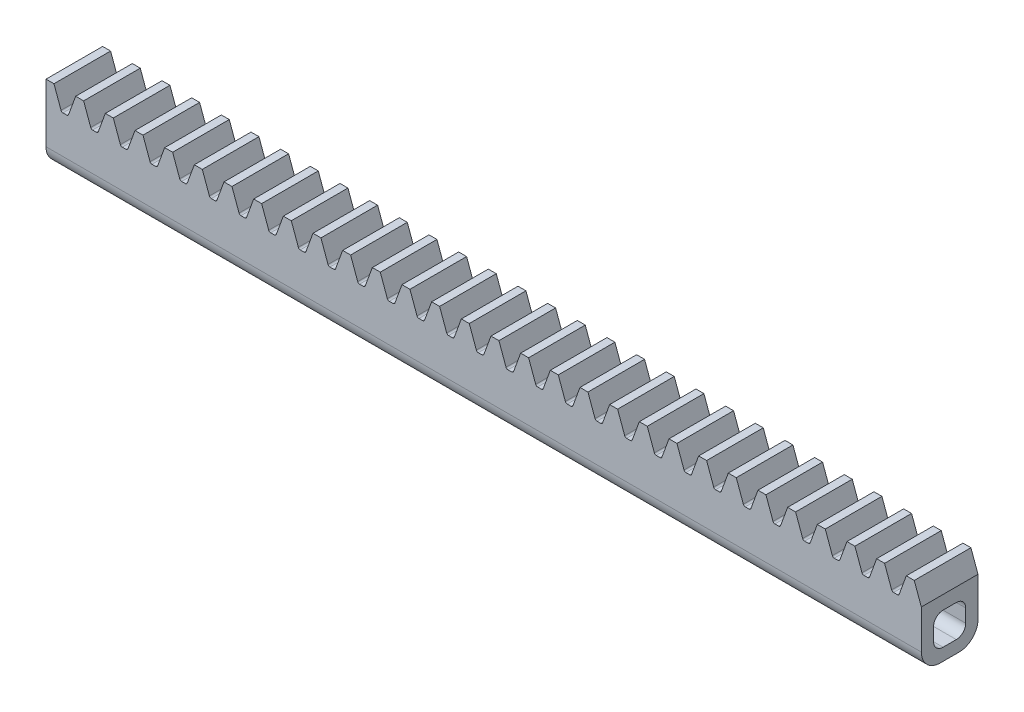
from build123d import *

# Parameters (mm, degrees)
BOSS_EXTRUDE1_DEPTH             = 157.5
BOSS_EXTRUDE1_DEPTH_BACK        = 157.5
SKETCH3_W                       = 10
SKETCH3_H                       = 10
CUT_EXTRUDE1_DEPTH              = 158.658650254
FILLET1_R                       = 0.209179931
LPATTERN1_START                 = -5
LPATTERN1_DEPTH                 = 10
SKETCH7_W                       = 229.169539732
SKETCH7_H                       = 18.859276409
CUT_EXTRUDE2_DEPTH              = 10
SKETCH9_W                       = 103.614124197
SKETCH9_H                       = 20.396946695
CUT_EXTRUDE4_DEPTH              = 4
SKETCH12_W                      = 3.4
SKETCH12_H                      = 3.4
CUT_EXTRUDE7_DEPTH              = 97.57510207
FILLET2_R                       = 1
CUT_EXTRUDE8_DEPTH              = 158.69353189
SKETCH14_W                      = 6
SKETCH14_H                      = 1.8
CUT_EXTRUDE9_DEPTH              = 93.968900729
FILLET3_R                       = 2
CUT_EXTRUDE10_REACH             = 159.793
SKETCH15_R                      = 1
CUT_EXTRUDE10_DIRECTION_2_DEPTH = 158.79255369
CUT_EXTRUDE11_REACH             = 159.793
SKETCH16_R                      = 1


# Read off the part's stored shape, not the designer's step: LPattern1
with BuildPart() as part:
    # Sketch3 → Boss-Extrude1 (new, two sides: drawn at the far end of the back side and taken through both)
    with BuildSketch(Plane(origin=(0, 0, 0), x_dir=(0, 0, -1), z_dir=(1, 0, 0)).offset(-BOSS_EXTRUDE1_DEPTH_BACK)):
        Rectangle(SKETCH3_W, SKETCH3_H)
    extrude(amount=BOSS_EXTRUDE1_DEPTH + BOSS_EXTRUDE1_DEPTH_BACK)

    # Sketch4 → Cut-Extrude1 (cut, symmetric)
    with BuildSketch(Plane.XY):
        Polygon((-156.657145469, 5), (-155.856410953, 2.8), (-155.159144515, 2.8), (-154.35841, 5), align=None)
    extrude(amount=CUT_EXTRUDE1_DEPTH, both=True, mode=Mode.SUBTRACT)

    # Fillet1
    fillet1_edges = [part.edges().sort_by_distance(p)[0] for p in [
        (-155.159144515, 2.8, 0),
        (-155.856410953, 2.8, 0),
    ]]
    fillet(fillet1_edges, radius=FILLET1_R)

    # LPattern1 outline → LPattern1 (cut)
    with BuildSketch(Plane.XY.offset(LPATTERN1_START)):
        with BuildLine():
            ThreePointArc((-152.764916426, 2.937636181), (-152.688332268, 2.837829763), (-152.568351588, 2.8))
            Line((-152.568351588, 2.8), (-152.16402388, 2.8))
            ThreePointArc((-152.16402388, 2.8), (-152.044043201, 2.837829763), (-151.967459042, 2.937636181))
            Line((-151.967459042, 2.937636181), (-151.21682, 5))
            Line((-151.21682, 5), (-153.515555469, 5))
            Line((-153.515555469, 5), (-152.764916426, 2.937636181))
        make_face()
        with BuildLine():
            Line((156.659, 5), (154.360264531, 5))
            Line((154.360264531, 5), (155.110903574, 2.937636181))
            ThreePointArc((155.110903574, 2.937636181), (155.187487732, 2.837829763), (155.307468412, 2.8))
            Line((155.307468412, 2.8), (155.71179612, 2.8))
            ThreePointArc((155.71179612, 2.8), (155.831776799, 2.837829763), (155.908360958, 2.937636181))
            Line((155.908360958, 2.937636181), (156.659, 5))
        make_face()
        with BuildLine():
            Line((153.51741, 5), (151.218674531, 5))
            Line((151.218674531, 5), (151.969313574, 2.937636181))
            ThreePointArc((151.969313574, 2.937636181), (152.045897732, 2.837829763), (152.165878412, 2.8))
            Line((152.165878412, 2.8), (152.57020612, 2.8))
            ThreePointArc((152.57020612, 2.8), (152.690186799, 2.837829763), (152.766770958, 2.937636181))
            Line((152.766770958, 2.937636181), (153.51741, 5))
        make_face()
        with BuildLine():
            Line((150.37582, 5), (148.077084531, 5))
            Line((148.077084531, 5), (148.827723574, 2.937636181))
            ThreePointArc((148.827723574, 2.937636181), (148.904307732, 2.837829763), (149.024288412, 2.8))
            Line((149.024288412, 2.8), (149.42861612, 2.8))
            ThreePointArc((149.42861612, 2.8), (149.548596799, 2.837829763), (149.625180958, 2.937636181))
            Line((149.625180958, 2.937636181), (150.37582, 5))
        make_face()
        with BuildLine():
            Line((147.23423, 5), (144.935494531, 5))
            Line((144.935494531, 5), (145.686133574, 2.937636181))
            ThreePointArc((145.686133574, 2.937636181), (145.762717732, 2.837829763), (145.882698412, 2.8))
            Line((145.882698412, 2.8), (146.28702612, 2.8))
            ThreePointArc((146.28702612, 2.8), (146.407006799, 2.837829763), (146.483590958, 2.937636181))
            Line((146.483590958, 2.937636181), (147.23423, 5))
        make_face()
        with BuildLine():
            Line((144.09264, 5), (141.793904531, 5))
            Line((141.793904531, 5), (142.544543574, 2.937636181))
            ThreePointArc((142.544543574, 2.937636181), (142.621127732, 2.837829763), (142.741108412, 2.8))
            Line((142.741108412, 2.8), (143.14543612, 2.8))
            ThreePointArc((143.14543612, 2.8), (143.265416799, 2.837829763), (143.342000958, 2.937636181))
            Line((143.342000958, 2.937636181), (144.09264, 5))
        make_face()
        with BuildLine():
            Line((140.95105, 5), (138.652314531, 5))
            Line((138.652314531, 5), (139.402953574, 2.937636181))
            ThreePointArc((139.402953574, 2.937636181), (139.479537732, 2.837829763), (139.599518412, 2.8))
            Line((139.599518412, 2.8), (140.00384612, 2.8))
            ThreePointArc((140.00384612, 2.8), (140.123826799, 2.837829763), (140.200410958, 2.937636181))
            Line((140.200410958, 2.937636181), (140.95105, 5))
        make_face()
        with BuildLine():
            Line((137.80946, 5), (135.510724531, 5))
            Line((135.510724531, 5), (136.261363574, 2.937636181))
            ThreePointArc((136.261363574, 2.937636181), (136.337947732, 2.837829763), (136.457928412, 2.8))
            Line((136.457928412, 2.8), (136.86225612, 2.8))
            ThreePointArc((136.86225612, 2.8), (136.982236799, 2.837829763), (137.058820958, 2.937636181))
            Line((137.058820958, 2.937636181), (137.80946, 5))
        make_face()
        with BuildLine():
            Line((134.66787, 5), (132.369134531, 5))
            Line((132.369134531, 5), (133.119773574, 2.937636181))
            ThreePointArc((133.119773574, 2.937636181), (133.196357732, 2.837829763), (133.316338412, 2.8))
            Line((133.316338412, 2.8), (133.72066612, 2.8))
            ThreePointArc((133.72066612, 2.8), (133.840646799, 2.837829763), (133.917230958, 2.937636181))
            Line((133.917230958, 2.937636181), (134.66787, 5))
        make_face()
        with BuildLine():
            Line((131.52628, 5), (129.227544531, 5))
            Line((129.227544531, 5), (129.978183574, 2.937636181))
            ThreePointArc((129.978183574, 2.937636181), (130.054767732, 2.837829763), (130.174748412, 2.8))
            Line((130.174748412, 2.8), (130.57907612, 2.8))
            ThreePointArc((130.57907612, 2.8), (130.699056799, 2.837829763), (130.775640958, 2.937636181))
            Line((130.775640958, 2.937636181), (131.52628, 5))
        make_face()
        with BuildLine():
            Line((128.38469, 5), (126.085954531, 5))
            Line((126.085954531, 5), (126.836593574, 2.937636181))
            ThreePointArc((126.836593574, 2.937636181), (126.913177732, 2.837829763), (127.033158412, 2.8))
            Line((127.033158412, 2.8), (127.43748612, 2.8))
            ThreePointArc((127.43748612, 2.8), (127.557466799, 2.837829763), (127.634050958, 2.937636181))
            Line((127.634050958, 2.937636181), (128.38469, 5))
        make_face()
        with BuildLine():
            Line((125.2431, 5), (122.944364531, 5))
            Line((122.944364531, 5), (123.695003574, 2.937636181))
            ThreePointArc((123.695003574, 2.937636181), (123.771587732, 2.837829763), (123.891568412, 2.8))
            Line((123.891568412, 2.8), (124.29589612, 2.8))
            ThreePointArc((124.29589612, 2.8), (124.415876799, 2.837829763), (124.492460958, 2.937636181))
            Line((124.492460958, 2.937636181), (125.2431, 5))
        make_face()
        with BuildLine():
            Line((122.10151, 5), (119.802774531, 5))
            Line((119.802774531, 5), (120.553413574, 2.937636181))
            ThreePointArc((120.553413574, 2.937636181), (120.629997732, 2.837829763), (120.749978412, 2.8))
            Line((120.749978412, 2.8), (121.15430612, 2.8))
            ThreePointArc((121.15430612, 2.8), (121.274286799, 2.837829763), (121.350870958, 2.937636181))
            Line((121.350870958, 2.937636181), (122.10151, 5))
        make_face()
        with BuildLine():
            Line((118.95992, 5), (116.661184531, 5))
            Line((116.661184531, 5), (117.411823574, 2.937636181))
            ThreePointArc((117.411823574, 2.937636181), (117.488407732, 2.837829763), (117.608388412, 2.8))
            Line((117.608388412, 2.8), (118.01271612, 2.8))
            ThreePointArc((118.01271612, 2.8), (118.132696799, 2.837829763), (118.209280958, 2.937636181))
            Line((118.209280958, 2.937636181), (118.95992, 5))
        make_face()
        with BuildLine():
            Line((115.81833, 5), (113.519594531, 5))
            Line((113.519594531, 5), (114.270233574, 2.937636181))
            ThreePointArc((114.270233574, 2.937636181), (114.346817732, 2.837829763), (114.466798412, 2.8))
            Line((114.466798412, 2.8), (114.87112612, 2.8))
            ThreePointArc((114.87112612, 2.8), (114.991106799, 2.837829763), (115.067690958, 2.937636181))
            Line((115.067690958, 2.937636181), (115.81833, 5))
        make_face()
        with BuildLine():
            Line((112.67674, 5), (110.378004531, 5))
            Line((110.378004531, 5), (111.128643574, 2.937636181))
            ThreePointArc((111.128643574, 2.937636181), (111.205227732, 2.837829763), (111.325208412, 2.8))
            Line((111.325208412, 2.8), (111.72953612, 2.8))
            ThreePointArc((111.72953612, 2.8), (111.849516799, 2.837829763), (111.926100958, 2.937636181))
            Line((111.926100958, 2.937636181), (112.67674, 5))
        make_face()
        with BuildLine():
            Line((109.53515, 5), (107.236414531, 5))
            Line((107.236414531, 5), (107.987053574, 2.937636181))
            ThreePointArc((107.987053574, 2.937636181), (108.063637732, 2.837829763), (108.183618412, 2.8))
            Line((108.183618412, 2.8), (108.58794612, 2.8))
            ThreePointArc((108.58794612, 2.8), (108.707926799, 2.837829763), (108.784510958, 2.937636181))
            Line((108.784510958, 2.937636181), (109.53515, 5))
        make_face()
        with BuildLine():
            Line((106.39356, 5), (104.094824531, 5))
            Line((104.094824531, 5), (104.845463574, 2.937636181))
            ThreePointArc((104.845463574, 2.937636181), (104.922047732, 2.837829763), (105.042028412, 2.8))
            Line((105.042028412, 2.8), (105.44635612, 2.8))
            ThreePointArc((105.44635612, 2.8), (105.566336799, 2.837829763), (105.642920958, 2.937636181))
            Line((105.642920958, 2.937636181), (106.39356, 5))
        make_face()
        with BuildLine():
            Line((103.25197, 5), (100.953234531, 5))
            Line((100.953234531, 5), (101.703873574, 2.937636181))
            ThreePointArc((101.703873574, 2.937636181), (101.780457732, 2.837829763), (101.900438412, 2.8))
            Line((101.900438412, 2.8), (102.30476612, 2.8))
            ThreePointArc((102.30476612, 2.8), (102.424746799, 2.837829763), (102.501330958, 2.937636181))
            Line((102.501330958, 2.937636181), (103.25197, 5))
        make_face()
        with BuildLine():
            Line((100.11038, 5), (97.811644531, 5))
            Line((97.811644531, 5), (98.562283574, 2.937636181))
            ThreePointArc((98.562283574, 2.937636181), (98.638867732, 2.837829763), (98.758848412, 2.8))
            Line((98.758848412, 2.8), (99.16317612, 2.8))
            ThreePointArc((99.16317612, 2.8), (99.283156799, 2.837829763), (99.359740958, 2.937636181))
            Line((99.359740958, 2.937636181), (100.11038, 5))
        make_face()
        with BuildLine():
            Line((96.96879, 5), (94.670054531, 5))
            Line((94.670054531, 5), (95.420693574, 2.937636181))
            ThreePointArc((95.420693574, 2.937636181), (95.497277732, 2.837829763), (95.617258412, 2.8))
            Line((95.617258412, 2.8), (96.02158612, 2.8))
            ThreePointArc((96.02158612, 2.8), (96.141566799, 2.837829763), (96.218150958, 2.937636181))
            Line((96.218150958, 2.937636181), (96.96879, 5))
        make_face()
        with BuildLine():
            Line((93.8272, 5), (91.528464531, 5))
            Line((91.528464531, 5), (92.279103574, 2.937636181))
            ThreePointArc((92.279103574, 2.937636181), (92.355687732, 2.837829763), (92.475668412, 2.8))
            Line((92.475668412, 2.8), (92.87999612, 2.8))
            ThreePointArc((92.87999612, 2.8), (92.999976799, 2.837829763), (93.076560958, 2.937636181))
            Line((93.076560958, 2.937636181), (93.8272, 5))
        make_face()
        with BuildLine():
            Line((90.68561, 5), (88.386874531, 5))
            Line((88.386874531, 5), (89.137513574, 2.937636181))
            ThreePointArc((89.137513574, 2.937636181), (89.214097732, 2.837829763), (89.334078412, 2.8))
            Line((89.334078412, 2.8), (89.73840612, 2.8))
            ThreePointArc((89.73840612, 2.8), (89.858386799, 2.837829763), (89.934970958, 2.937636181))
            Line((89.934970958, 2.937636181), (90.68561, 5))
        make_face()
        with BuildLine():
            Line((87.54402, 5), (85.245284531, 5))
            Line((85.245284531, 5), (85.995923574, 2.937636181))
            ThreePointArc((85.995923574, 2.937636181), (86.072507732, 2.837829763), (86.192488412, 2.8))
            Line((86.192488412, 2.8), (86.59681612, 2.8))
            ThreePointArc((86.59681612, 2.8), (86.716796799, 2.837829763), (86.793380958, 2.937636181))
            Line((86.793380958, 2.937636181), (87.54402, 5))
        make_face()
        with BuildLine():
            Line((84.40243, 5), (82.103694531, 5))
            Line((82.103694531, 5), (82.854333574, 2.937636181))
            ThreePointArc((82.854333574, 2.937636181), (82.930917732, 2.837829763), (83.050898412, 2.8))
            Line((83.050898412, 2.8), (83.45522612, 2.8))
            ThreePointArc((83.45522612, 2.8), (83.575206799, 2.837829763), (83.651790958, 2.937636181))
            Line((83.651790958, 2.937636181), (84.40243, 5))
        make_face()
        with BuildLine():
            Line((81.26084, 5), (78.962104531, 5))
            Line((78.962104531, 5), (79.712743574, 2.937636181))
            ThreePointArc((79.712743574, 2.937636181), (79.789327732, 2.837829763), (79.909308412, 2.8))
            Line((79.909308412, 2.8), (80.31363612, 2.8))
            ThreePointArc((80.31363612, 2.8), (80.433616799, 2.837829763), (80.510200958, 2.937636181))
            Line((80.510200958, 2.937636181), (81.26084, 5))
        make_face()
        with BuildLine():
            Line((78.11925, 5), (75.820514531, 5))
            Line((75.820514531, 5), (76.571153574, 2.937636181))
            ThreePointArc((76.571153574, 2.937636181), (76.647737732, 2.837829763), (76.767718412, 2.8))
            Line((76.767718412, 2.8), (77.17204612, 2.8))
            ThreePointArc((77.17204612, 2.8), (77.292026799, 2.837829763), (77.368610958, 2.937636181))
            Line((77.368610958, 2.937636181), (78.11925, 5))
        make_face()
        with BuildLine():
            Line((74.97766, 5), (72.678924531, 5))
            Line((72.678924531, 5), (73.429563574, 2.937636181))
            ThreePointArc((73.429563574, 2.937636181), (73.506147732, 2.837829763), (73.626128412, 2.8))
            Line((73.626128412, 2.8), (74.03045612, 2.8))
            ThreePointArc((74.03045612, 2.8), (74.150436799, 2.837829763), (74.227020958, 2.937636181))
            Line((74.227020958, 2.937636181), (74.97766, 5))
        make_face()
        with BuildLine():
            Line((71.83607, 5), (69.537334531, 5))
            Line((69.537334531, 5), (70.287973574, 2.937636181))
            ThreePointArc((70.287973574, 2.937636181), (70.364557732, 2.837829763), (70.484538412, 2.8))
            Line((70.484538412, 2.8), (70.88886612, 2.8))
            ThreePointArc((70.88886612, 2.8), (71.008846799, 2.837829763), (71.085430958, 2.937636181))
            Line((71.085430958, 2.937636181), (71.83607, 5))
        make_face()
        with BuildLine():
            Line((68.69448, 5), (66.395744531, 5))
            Line((66.395744531, 5), (67.146383574, 2.937636181))
            ThreePointArc((67.146383574, 2.937636181), (67.222967732, 2.837829763), (67.342948412, 2.8))
            Line((67.342948412, 2.8), (67.74727612, 2.8))
            ThreePointArc((67.74727612, 2.8), (67.867256799, 2.837829763), (67.943840958, 2.937636181))
            Line((67.943840958, 2.937636181), (68.69448, 5))
        make_face()
        with BuildLine():
            Line((65.55289, 5), (63.254154531, 5))
            Line((63.254154531, 5), (64.004793574, 2.937636181))
            ThreePointArc((64.004793574, 2.937636181), (64.081377732, 2.837829763), (64.201358412, 2.8))
            Line((64.201358412, 2.8), (64.60568612, 2.8))
            ThreePointArc((64.60568612, 2.8), (64.725666799, 2.837829763), (64.802250958, 2.937636181))
            Line((64.802250958, 2.937636181), (65.55289, 5))
        make_face()
        with BuildLine():
            Line((62.4113, 5), (60.112564531, 5))
            Line((60.112564531, 5), (60.863203574, 2.937636181))
            ThreePointArc((60.863203574, 2.937636181), (60.939787732, 2.837829763), (61.059768412, 2.8))
            Line((61.059768412, 2.8), (61.46409612, 2.8))
            ThreePointArc((61.46409612, 2.8), (61.584076799, 2.837829763), (61.660660958, 2.937636181))
            Line((61.660660958, 2.937636181), (62.4113, 5))
        make_face()
        with BuildLine():
            Line((59.26971, 5), (56.970974531, 5))
            Line((56.970974531, 5), (57.721613574, 2.937636181))
            ThreePointArc((57.721613574, 2.937636181), (57.798197732, 2.837829763), (57.918178412, 2.8))
            Line((57.918178412, 2.8), (58.32250612, 2.8))
            ThreePointArc((58.32250612, 2.8), (58.442486799, 2.837829763), (58.519070958, 2.937636181))
            Line((58.519070958, 2.937636181), (59.26971, 5))
        make_face()
        with BuildLine():
            Line((56.12812, 5), (53.829384531, 5))
            Line((53.829384531, 5), (54.580023574, 2.937636181))
            ThreePointArc((54.580023574, 2.937636181), (54.656607732, 2.837829763), (54.776588412, 2.8))
            Line((54.776588412, 2.8), (55.18091612, 2.8))
            ThreePointArc((55.18091612, 2.8), (55.300896799, 2.837829763), (55.377480958, 2.937636181))
            Line((55.377480958, 2.937636181), (56.12812, 5))
        make_face()
        with BuildLine():
            Line((52.98653, 5), (50.687794531, 5))
            Line((50.687794531, 5), (51.438433574, 2.937636181))
            ThreePointArc((51.438433574, 2.937636181), (51.515017732, 2.837829763), (51.634998412, 2.8))
            Line((51.634998412, 2.8), (52.03932612, 2.8))
            ThreePointArc((52.03932612, 2.8), (52.159306799, 2.837829763), (52.235890958, 2.937636181))
            Line((52.235890958, 2.937636181), (52.98653, 5))
        make_face()
        with BuildLine():
            Line((49.84494, 5), (47.546204531, 5))
            Line((47.546204531, 5), (48.296843574, 2.937636181))
            ThreePointArc((48.296843574, 2.937636181), (48.373427732, 2.837829763), (48.493408412, 2.8))
            Line((48.493408412, 2.8), (48.89773612, 2.8))
            ThreePointArc((48.89773612, 2.8), (49.017716799, 2.837829763), (49.094300958, 2.937636181))
            Line((49.094300958, 2.937636181), (49.84494, 5))
        make_face()
        with BuildLine():
            Line((46.70335, 5), (44.404614531, 5))
            Line((44.404614531, 5), (45.155253574, 2.937636181))
            ThreePointArc((45.155253574, 2.937636181), (45.231837732, 2.837829763), (45.351818412, 2.8))
            Line((45.351818412, 2.8), (45.75614612, 2.8))
            ThreePointArc((45.75614612, 2.8), (45.876126799, 2.837829763), (45.952710958, 2.937636181))
            Line((45.952710958, 2.937636181), (46.70335, 5))
        make_face()
        with BuildLine():
            Line((43.56176, 5), (41.263024531, 5))
            Line((41.263024531, 5), (42.013663574, 2.937636181))
            ThreePointArc((42.013663574, 2.937636181), (42.090247732, 2.837829763), (42.210228412, 2.8))
            Line((42.210228412, 2.8), (42.61455612, 2.8))
            ThreePointArc((42.61455612, 2.8), (42.734536799, 2.837829763), (42.811120958, 2.937636181))
            Line((42.811120958, 2.937636181), (43.56176, 5))
        make_face()
        with BuildLine():
            Line((40.42017, 5), (38.121434531, 5))
            Line((38.121434531, 5), (38.872073574, 2.937636181))
            ThreePointArc((38.872073574, 2.937636181), (38.948657732, 2.837829763), (39.068638412, 2.8))
            Line((39.068638412, 2.8), (39.47296612, 2.8))
            ThreePointArc((39.47296612, 2.8), (39.592946799, 2.837829763), (39.669530958, 2.937636181))
            Line((39.669530958, 2.937636181), (40.42017, 5))
        make_face()
        with BuildLine():
            Line((37.27858, 5), (34.979844531, 5))
            Line((34.979844531, 5), (35.730483574, 2.937636181))
            ThreePointArc((35.730483574, 2.937636181), (35.807067732, 2.837829763), (35.927048412, 2.8))
            Line((35.927048412, 2.8), (36.33137612, 2.8))
            ThreePointArc((36.33137612, 2.8), (36.451356799, 2.837829763), (36.527940958, 2.937636181))
            Line((36.527940958, 2.937636181), (37.27858, 5))
        make_face()
        with BuildLine():
            Line((34.13699, 5), (31.838254531, 5))
            Line((31.838254531, 5), (32.588893574, 2.937636181))
            ThreePointArc((32.588893574, 2.937636181), (32.665477732, 2.837829763), (32.785458412, 2.8))
            Line((32.785458412, 2.8), (33.18978612, 2.8))
            ThreePointArc((33.18978612, 2.8), (33.309766799, 2.837829763), (33.386350958, 2.937636181))
            Line((33.386350958, 2.937636181), (34.13699, 5))
        make_face()
        with BuildLine():
            Line((30.9954, 5), (28.696664531, 5))
            Line((28.696664531, 5), (29.447303574, 2.937636181))
            ThreePointArc((29.447303574, 2.937636181), (29.523887732, 2.837829763), (29.643868412, 2.8))
            Line((29.643868412, 2.8), (30.04819612, 2.8))
            ThreePointArc((30.04819612, 2.8), (30.168176799, 2.837829763), (30.244760958, 2.937636181))
            Line((30.244760958, 2.937636181), (30.9954, 5))
        make_face()
        with BuildLine():
            Line((27.85381, 5), (25.555074531, 5))
            Line((25.555074531, 5), (26.305713574, 2.937636181))
            ThreePointArc((26.305713574, 2.937636181), (26.382297732, 2.837829763), (26.502278412, 2.8))
            Line((26.502278412, 2.8), (26.90660612, 2.8))
            ThreePointArc((26.90660612, 2.8), (27.026586799, 2.837829763), (27.103170958, 2.937636181))
            Line((27.103170958, 2.937636181), (27.85381, 5))
        make_face()
        with BuildLine():
            Line((24.71222, 5), (22.413484531, 5))
            Line((22.413484531, 5), (23.164123574, 2.937636181))
            ThreePointArc((23.164123574, 2.937636181), (23.240707732, 2.837829763), (23.360688412, 2.8))
            Line((23.360688412, 2.8), (23.76501612, 2.8))
            ThreePointArc((23.76501612, 2.8), (23.884996799, 2.837829763), (23.961580958, 2.937636181))
            Line((23.961580958, 2.937636181), (24.71222, 5))
        make_face()
        with BuildLine():
            Line((21.57063, 5), (19.271894531, 5))
            Line((19.271894531, 5), (20.022533574, 2.937636181))
            ThreePointArc((20.022533574, 2.937636181), (20.099117732, 2.837829763), (20.219098412, 2.8))
            Line((20.219098412, 2.8), (20.62342612, 2.8))
            ThreePointArc((20.62342612, 2.8), (20.743406799, 2.837829763), (20.819990958, 2.937636181))
            Line((20.819990958, 2.937636181), (21.57063, 5))
        make_face()
        with BuildLine():
            Line((18.42904, 5), (16.130304531, 5))
            Line((16.130304531, 5), (16.880943574, 2.937636181))
            ThreePointArc((16.880943574, 2.937636181), (16.957527732, 2.837829763), (17.077508412, 2.8))
            Line((17.077508412, 2.8), (17.48183612, 2.8))
            ThreePointArc((17.48183612, 2.8), (17.601816799, 2.837829763), (17.678400958, 2.937636181))
            Line((17.678400958, 2.937636181), (18.42904, 5))
        make_face()
        with BuildLine():
            Line((15.28745, 5), (12.988714531, 5))
            Line((12.988714531, 5), (13.739353574, 2.937636181))
            ThreePointArc((13.739353574, 2.937636181), (13.815937732, 2.837829763), (13.935918412, 2.8))
            Line((13.935918412, 2.8), (14.34024612, 2.8))
            ThreePointArc((14.34024612, 2.8), (14.460226799, 2.837829763), (14.536810958, 2.937636181))
            Line((14.536810958, 2.937636181), (15.28745, 5))
        make_face()
        with BuildLine():
            Line((12.14586, 5), (9.847124531, 5))
            Line((9.847124531, 5), (10.597763574, 2.937636181))
            ThreePointArc((10.597763574, 2.937636181), (10.674347732, 2.837829763), (10.794328412, 2.8))
            Line((10.794328412, 2.8), (11.19865612, 2.8))
            ThreePointArc((11.19865612, 2.8), (11.318636799, 2.837829763), (11.395220958, 2.937636181))
            Line((11.395220958, 2.937636181), (12.14586, 5))
        make_face()
        with BuildLine():
            Line((9.00427, 5), (6.705534531, 5))
            Line((6.705534531, 5), (7.456173574, 2.937636181))
            ThreePointArc((7.456173574, 2.937636181), (7.532757732, 2.837829763), (7.652738412, 2.8))
            Line((7.652738412, 2.8), (8.05706612, 2.8))
            ThreePointArc((8.05706612, 2.8), (8.177046799, 2.837829763), (8.253630958, 2.937636181))
            Line((8.253630958, 2.937636181), (9.00427, 5))
        make_face()
        with BuildLine():
            Line((5.86268, 5), (3.563944531, 5))
            Line((3.563944531, 5), (4.314583574, 2.937636181))
            ThreePointArc((4.314583574, 2.937636181), (4.391167732, 2.837829763), (4.511148412, 2.8))
            Line((4.511148412, 2.8), (4.91547612, 2.8))
            ThreePointArc((4.91547612, 2.8), (5.035456799, 2.837829763), (5.112040958, 2.937636181))
            Line((5.112040958, 2.937636181), (5.86268, 5))
        make_face()
        with BuildLine():
            Line((2.72109, 5), (0.422354531, 5))
            Line((0.422354531, 5), (1.172993574, 2.937636181))
            ThreePointArc((1.172993574, 2.937636181), (1.249577732, 2.837829763), (1.369558412, 2.8))
            Line((1.369558412, 2.8), (1.77388612, 2.8))
            ThreePointArc((1.77388612, 2.8), (1.893866799, 2.837829763), (1.970450958, 2.937636181))
            Line((1.970450958, 2.937636181), (2.72109, 5))
        make_face()
        with BuildLine():
            Line((-0.4205, 5), (-2.719235469, 5))
            Line((-2.719235469, 5), (-1.968596426, 2.937636181))
            ThreePointArc((-1.968596426, 2.937636181), (-1.892012268, 2.837829763), (-1.772031588, 2.8))
            Line((-1.772031588, 2.8), (-1.36770388, 2.8))
            ThreePointArc((-1.36770388, 2.8), (-1.247723201, 2.837829763), (-1.171139042, 2.937636181))
            Line((-1.171139042, 2.937636181), (-0.4205, 5))
        make_face()
        with BuildLine():
            Line((-3.56209, 5), (-5.860825469, 5))
            Line((-5.860825469, 5), (-5.110186426, 2.937636181))
            ThreePointArc((-5.110186426, 2.937636181), (-5.033602268, 2.837829763), (-4.913621588, 2.8))
            Line((-4.913621588, 2.8), (-4.50929388, 2.8))
            ThreePointArc((-4.50929388, 2.8), (-4.389313201, 2.837829763), (-4.312729042, 2.937636181))
            Line((-4.312729042, 2.937636181), (-3.56209, 5))
        make_face()
        with BuildLine():
            Line((-6.70368, 5), (-9.002415469, 5))
            Line((-9.002415469, 5), (-8.251776426, 2.937636181))
            ThreePointArc((-8.251776426, 2.937636181), (-8.175192268, 2.837829763), (-8.055211588, 2.8))
            Line((-8.055211588, 2.8), (-7.65088388, 2.8))
            ThreePointArc((-7.65088388, 2.8), (-7.530903201, 2.837829763), (-7.454319042, 2.937636181))
            Line((-7.454319042, 2.937636181), (-6.70368, 5))
        make_face()
        with BuildLine():
            Line((-9.84527, 5), (-12.144005469, 5))
            Line((-12.144005469, 5), (-11.393366426, 2.937636181))
            ThreePointArc((-11.393366426, 2.937636181), (-11.316782268, 2.837829763), (-11.196801588, 2.8))
            Line((-11.196801588, 2.8), (-10.79247388, 2.8))
            ThreePointArc((-10.79247388, 2.8), (-10.672493201, 2.837829763), (-10.595909042, 2.937636181))
            Line((-10.595909042, 2.937636181), (-9.84527, 5))
        make_face()
        with BuildLine():
            Line((-12.98686, 5), (-15.285595469, 5))
            Line((-15.285595469, 5), (-14.534956426, 2.937636181))
            ThreePointArc((-14.534956426, 2.937636181), (-14.458372268, 2.837829763), (-14.338391588, 2.8))
            Line((-14.338391588, 2.8), (-13.93406388, 2.8))
            ThreePointArc((-13.93406388, 2.8), (-13.814083201, 2.837829763), (-13.737499042, 2.937636181))
            Line((-13.737499042, 2.937636181), (-12.98686, 5))
        make_face()
        with BuildLine():
            Line((-16.12845, 5), (-18.427185469, 5))
            Line((-18.427185469, 5), (-17.676546426, 2.937636181))
            ThreePointArc((-17.676546426, 2.937636181), (-17.599962268, 2.837829763), (-17.479981588, 2.8))
            Line((-17.479981588, 2.8), (-17.07565388, 2.8))
            ThreePointArc((-17.07565388, 2.8), (-16.955673201, 2.837829763), (-16.879089042, 2.937636181))
            Line((-16.879089042, 2.937636181), (-16.12845, 5))
        make_face()
        with BuildLine():
            Line((-19.27004, 5), (-21.568775469, 5))
            Line((-21.568775469, 5), (-20.818136426, 2.937636181))
            ThreePointArc((-20.818136426, 2.937636181), (-20.741552268, 2.837829763), (-20.621571588, 2.8))
            Line((-20.621571588, 2.8), (-20.21724388, 2.8))
            ThreePointArc((-20.21724388, 2.8), (-20.097263201, 2.837829763), (-20.020679042, 2.937636181))
            Line((-20.020679042, 2.937636181), (-19.27004, 5))
        make_face()
        with BuildLine():
            Line((-22.41163, 5), (-24.710365469, 5))
            Line((-24.710365469, 5), (-23.959726426, 2.937636181))
            ThreePointArc((-23.959726426, 2.937636181), (-23.883142268, 2.837829763), (-23.763161588, 2.8))
            Line((-23.763161588, 2.8), (-23.35883388, 2.8))
            ThreePointArc((-23.35883388, 2.8), (-23.238853201, 2.837829763), (-23.162269042, 2.937636181))
            Line((-23.162269042, 2.937636181), (-22.41163, 5))
        make_face()
        with BuildLine():
            Line((-25.55322, 5), (-27.851955469, 5))
            Line((-27.851955469, 5), (-27.101316426, 2.937636181))
            ThreePointArc((-27.101316426, 2.937636181), (-27.024732268, 2.837829763), (-26.904751588, 2.8))
            Line((-26.904751588, 2.8), (-26.50042388, 2.8))
            ThreePointArc((-26.50042388, 2.8), (-26.380443201, 2.837829763), (-26.303859042, 2.937636181))
            Line((-26.303859042, 2.937636181), (-25.55322, 5))
        make_face()
        with BuildLine():
            Line((-28.69481, 5), (-30.993545469, 5))
            Line((-30.993545469, 5), (-30.242906426, 2.937636181))
            ThreePointArc((-30.242906426, 2.937636181), (-30.166322268, 2.837829763), (-30.046341588, 2.8))
            Line((-30.046341588, 2.8), (-29.64201388, 2.8))
            ThreePointArc((-29.64201388, 2.8), (-29.522033201, 2.837829763), (-29.445449042, 2.937636181))
            Line((-29.445449042, 2.937636181), (-28.69481, 5))
        make_face()
        with BuildLine():
            Line((-31.8364, 5), (-34.135135469, 5))
            Line((-34.135135469, 5), (-33.384496426, 2.937636181))
            ThreePointArc((-33.384496426, 2.937636181), (-33.307912268, 2.837829763), (-33.187931588, 2.8))
            Line((-33.187931588, 2.8), (-32.78360388, 2.8))
            ThreePointArc((-32.78360388, 2.8), (-32.663623201, 2.837829763), (-32.587039042, 2.937636181))
            Line((-32.587039042, 2.937636181), (-31.8364, 5))
        make_face()
        with BuildLine():
            Line((-34.97799, 5), (-37.276725469, 5))
            Line((-37.276725469, 5), (-36.526086426, 2.937636181))
            ThreePointArc((-36.526086426, 2.937636181), (-36.449502268, 2.837829763), (-36.329521588, 2.8))
            Line((-36.329521588, 2.8), (-35.92519388, 2.8))
            ThreePointArc((-35.92519388, 2.8), (-35.805213201, 2.837829763), (-35.728629042, 2.937636181))
            Line((-35.728629042, 2.937636181), (-34.97799, 5))
        make_face()
        with BuildLine():
            Line((-38.11958, 5), (-40.418315469, 5))
            Line((-40.418315469, 5), (-39.667676426, 2.937636181))
            ThreePointArc((-39.667676426, 2.937636181), (-39.591092268, 2.837829763), (-39.471111588, 2.8))
            Line((-39.471111588, 2.8), (-39.06678388, 2.8))
            ThreePointArc((-39.06678388, 2.8), (-38.946803201, 2.837829763), (-38.870219042, 2.937636181))
            Line((-38.870219042, 2.937636181), (-38.11958, 5))
        make_face()
        with BuildLine():
            Line((-41.26117, 5), (-43.559905469, 5))
            Line((-43.559905469, 5), (-42.809266426, 2.937636181))
            ThreePointArc((-42.809266426, 2.937636181), (-42.732682268, 2.837829763), (-42.612701588, 2.8))
            Line((-42.612701588, 2.8), (-42.20837388, 2.8))
            ThreePointArc((-42.20837388, 2.8), (-42.088393201, 2.837829763), (-42.011809042, 2.937636181))
            Line((-42.011809042, 2.937636181), (-41.26117, 5))
        make_face()
        with BuildLine():
            Line((-44.40276, 5), (-46.701495469, 5))
            Line((-46.701495469, 5), (-45.950856426, 2.937636181))
            ThreePointArc((-45.950856426, 2.937636181), (-45.874272268, 2.837829763), (-45.754291588, 2.8))
            Line((-45.754291588, 2.8), (-45.34996388, 2.8))
            ThreePointArc((-45.34996388, 2.8), (-45.229983201, 2.837829763), (-45.153399042, 2.937636181))
            Line((-45.153399042, 2.937636181), (-44.40276, 5))
        make_face()
        with BuildLine():
            Line((-47.54435, 5), (-49.843085469, 5))
            Line((-49.843085469, 5), (-49.092446426, 2.937636181))
            ThreePointArc((-49.092446426, 2.937636181), (-49.015862268, 2.837829763), (-48.895881588, 2.8))
            Line((-48.895881588, 2.8), (-48.49155388, 2.8))
            ThreePointArc((-48.49155388, 2.8), (-48.371573201, 2.837829763), (-48.294989042, 2.937636181))
            Line((-48.294989042, 2.937636181), (-47.54435, 5))
        make_face()
        with BuildLine():
            Line((-50.68594, 5), (-52.984675469, 5))
            Line((-52.984675469, 5), (-52.234036426, 2.937636181))
            ThreePointArc((-52.234036426, 2.937636181), (-52.157452268, 2.837829763), (-52.037471588, 2.8))
            Line((-52.037471588, 2.8), (-51.63314388, 2.8))
            ThreePointArc((-51.63314388, 2.8), (-51.513163201, 2.837829763), (-51.436579042, 2.937636181))
            Line((-51.436579042, 2.937636181), (-50.68594, 5))
        make_face()
        with BuildLine():
            Line((-53.82753, 5), (-56.126265469, 5))
            Line((-56.126265469, 5), (-55.375626426, 2.937636181))
            ThreePointArc((-55.375626426, 2.937636181), (-55.299042268, 2.837829763), (-55.179061588, 2.8))
            Line((-55.179061588, 2.8), (-54.77473388, 2.8))
            ThreePointArc((-54.77473388, 2.8), (-54.654753201, 2.837829763), (-54.578169042, 2.937636181))
            Line((-54.578169042, 2.937636181), (-53.82753, 5))
        make_face()
        with BuildLine():
            Line((-56.96912, 5), (-59.267855469, 5))
            Line((-59.267855469, 5), (-58.517216426, 2.937636181))
            ThreePointArc((-58.517216426, 2.937636181), (-58.440632268, 2.837829763), (-58.320651588, 2.8))
            Line((-58.320651588, 2.8), (-57.91632388, 2.8))
            ThreePointArc((-57.91632388, 2.8), (-57.796343201, 2.837829763), (-57.719759042, 2.937636181))
            Line((-57.719759042, 2.937636181), (-56.96912, 5))
        make_face()
        with BuildLine():
            Line((-60.11071, 5), (-62.409445469, 5))
            Line((-62.409445469, 5), (-61.658806426, 2.937636181))
            ThreePointArc((-61.658806426, 2.937636181), (-61.582222268, 2.837829763), (-61.462241588, 2.8))
            Line((-61.462241588, 2.8), (-61.05791388, 2.8))
            ThreePointArc((-61.05791388, 2.8), (-60.937933201, 2.837829763), (-60.861349042, 2.937636181))
            Line((-60.861349042, 2.937636181), (-60.11071, 5))
        make_face()
        with BuildLine():
            Line((-63.2523, 5), (-65.551035469, 5))
            Line((-65.551035469, 5), (-64.800396426, 2.937636181))
            ThreePointArc((-64.800396426, 2.937636181), (-64.723812268, 2.837829763), (-64.603831588, 2.8))
            Line((-64.603831588, 2.8), (-64.19950388, 2.8))
            ThreePointArc((-64.19950388, 2.8), (-64.079523201, 2.837829763), (-64.002939042, 2.937636181))
            Line((-64.002939042, 2.937636181), (-63.2523, 5))
        make_face()
        with BuildLine():
            Line((-66.39389, 5), (-68.692625469, 5))
            Line((-68.692625469, 5), (-67.941986426, 2.937636181))
            ThreePointArc((-67.941986426, 2.937636181), (-67.865402268, 2.837829763), (-67.745421588, 2.8))
            Line((-67.745421588, 2.8), (-67.34109388, 2.8))
            ThreePointArc((-67.34109388, 2.8), (-67.221113201, 2.837829763), (-67.144529042, 2.937636181))
            Line((-67.144529042, 2.937636181), (-66.39389, 5))
        make_face()
        with BuildLine():
            Line((-69.53548, 5), (-71.834215469, 5))
            Line((-71.834215469, 5), (-71.083576426, 2.937636181))
            ThreePointArc((-71.083576426, 2.937636181), (-71.006992268, 2.837829763), (-70.887011588, 2.8))
            Line((-70.887011588, 2.8), (-70.48268388, 2.8))
            ThreePointArc((-70.48268388, 2.8), (-70.362703201, 2.837829763), (-70.286119042, 2.937636181))
            Line((-70.286119042, 2.937636181), (-69.53548, 5))
        make_face()
        with BuildLine():
            Line((-72.67707, 5), (-74.975805469, 5))
            Line((-74.975805469, 5), (-74.225166426, 2.937636181))
            ThreePointArc((-74.225166426, 2.937636181), (-74.148582268, 2.837829763), (-74.028601588, 2.8))
            Line((-74.028601588, 2.8), (-73.62427388, 2.8))
            ThreePointArc((-73.62427388, 2.8), (-73.504293201, 2.837829763), (-73.427709042, 2.937636181))
            Line((-73.427709042, 2.937636181), (-72.67707, 5))
        make_face()
        with BuildLine():
            Line((-75.81866, 5), (-78.117395469, 5))
            Line((-78.117395469, 5), (-77.366756426, 2.937636181))
            ThreePointArc((-77.366756426, 2.937636181), (-77.290172268, 2.837829763), (-77.170191588, 2.8))
            Line((-77.170191588, 2.8), (-76.76586388, 2.8))
            ThreePointArc((-76.76586388, 2.8), (-76.645883201, 2.837829763), (-76.569299042, 2.937636181))
            Line((-76.569299042, 2.937636181), (-75.81866, 5))
        make_face()
        with BuildLine():
            Line((-78.96025, 5), (-81.258985469, 5))
            Line((-81.258985469, 5), (-80.508346426, 2.937636181))
            ThreePointArc((-80.508346426, 2.937636181), (-80.431762268, 2.837829763), (-80.311781588, 2.8))
            Line((-80.311781588, 2.8), (-79.90745388, 2.8))
            ThreePointArc((-79.90745388, 2.8), (-79.787473201, 2.837829763), (-79.710889042, 2.937636181))
            Line((-79.710889042, 2.937636181), (-78.96025, 5))
        make_face()
        with BuildLine():
            Line((-82.10184, 5), (-84.400575469, 5))
            Line((-84.400575469, 5), (-83.649936426, 2.937636181))
            ThreePointArc((-83.649936426, 2.937636181), (-83.573352268, 2.837829763), (-83.453371588, 2.8))
            Line((-83.453371588, 2.8), (-83.04904388, 2.8))
            ThreePointArc((-83.04904388, 2.8), (-82.929063201, 2.837829763), (-82.852479042, 2.937636181))
            Line((-82.852479042, 2.937636181), (-82.10184, 5))
        make_face()
        with BuildLine():
            Line((-85.24343, 5), (-87.542165469, 5))
            Line((-87.542165469, 5), (-86.791526426, 2.937636181))
            ThreePointArc((-86.791526426, 2.937636181), (-86.714942268, 2.837829763), (-86.594961588, 2.8))
            Line((-86.594961588, 2.8), (-86.19063388, 2.8))
            ThreePointArc((-86.19063388, 2.8), (-86.070653201, 2.837829763), (-85.994069042, 2.937636181))
            Line((-85.994069042, 2.937636181), (-85.24343, 5))
        make_face()
        with BuildLine():
            Line((-88.38502, 5), (-90.683755469, 5))
            Line((-90.683755469, 5), (-89.933116426, 2.937636181))
            ThreePointArc((-89.933116426, 2.937636181), (-89.856532268, 2.837829763), (-89.736551588, 2.8))
            Line((-89.736551588, 2.8), (-89.33222388, 2.8))
            ThreePointArc((-89.33222388, 2.8), (-89.212243201, 2.837829763), (-89.135659042, 2.937636181))
            Line((-89.135659042, 2.937636181), (-88.38502, 5))
        make_face()
        with BuildLine():
            Line((-91.52661, 5), (-93.825345469, 5))
            Line((-93.825345469, 5), (-93.074706426, 2.937636181))
            ThreePointArc((-93.074706426, 2.937636181), (-92.998122268, 2.837829763), (-92.878141588, 2.8))
            Line((-92.878141588, 2.8), (-92.47381388, 2.8))
            ThreePointArc((-92.47381388, 2.8), (-92.353833201, 2.837829763), (-92.277249042, 2.937636181))
            Line((-92.277249042, 2.937636181), (-91.52661, 5))
        make_face()
        with BuildLine():
            Line((-94.6682, 5), (-96.966935469, 5))
            Line((-96.966935469, 5), (-96.216296426, 2.937636181))
            ThreePointArc((-96.216296426, 2.937636181), (-96.139712268, 2.837829763), (-96.019731588, 2.8))
            Line((-96.019731588, 2.8), (-95.61540388, 2.8))
            ThreePointArc((-95.61540388, 2.8), (-95.495423201, 2.837829763), (-95.418839042, 2.937636181))
            Line((-95.418839042, 2.937636181), (-94.6682, 5))
        make_face()
        with BuildLine():
            Line((-97.80979, 5), (-100.108525469, 5))
            Line((-100.108525469, 5), (-99.357886426, 2.937636181))
            ThreePointArc((-99.357886426, 2.937636181), (-99.281302268, 2.837829763), (-99.161321588, 2.8))
            Line((-99.161321588, 2.8), (-98.75699388, 2.8))
            ThreePointArc((-98.75699388, 2.8), (-98.637013201, 2.837829763), (-98.560429042, 2.937636181))
            Line((-98.560429042, 2.937636181), (-97.80979, 5))
        make_face()
        with BuildLine():
            Line((-100.95138, 5), (-103.250115469, 5))
            Line((-103.250115469, 5), (-102.499476426, 2.937636181))
            ThreePointArc((-102.499476426, 2.937636181), (-102.422892268, 2.837829763), (-102.302911588, 2.8))
            Line((-102.302911588, 2.8), (-101.89858388, 2.8))
            ThreePointArc((-101.89858388, 2.8), (-101.778603201, 2.837829763), (-101.702019042, 2.937636181))
            Line((-101.702019042, 2.937636181), (-100.95138, 5))
        make_face()
        with BuildLine():
            Line((-104.09297, 5), (-106.391705469, 5))
            Line((-106.391705469, 5), (-105.641066426, 2.937636181))
            ThreePointArc((-105.641066426, 2.937636181), (-105.564482268, 2.837829763), (-105.444501588, 2.8))
            Line((-105.444501588, 2.8), (-105.04017388, 2.8))
            ThreePointArc((-105.04017388, 2.8), (-104.920193201, 2.837829763), (-104.843609042, 2.937636181))
            Line((-104.843609042, 2.937636181), (-104.09297, 5))
        make_face()
        with BuildLine():
            Line((-107.23456, 5), (-109.533295469, 5))
            Line((-109.533295469, 5), (-108.782656426, 2.937636181))
            ThreePointArc((-108.782656426, 2.937636181), (-108.706072268, 2.837829763), (-108.586091588, 2.8))
            Line((-108.586091588, 2.8), (-108.18176388, 2.8))
            ThreePointArc((-108.18176388, 2.8), (-108.061783201, 2.837829763), (-107.985199042, 2.937636181))
            Line((-107.985199042, 2.937636181), (-107.23456, 5))
        make_face()
        with BuildLine():
            Line((-110.37615, 5), (-112.674885469, 5))
            Line((-112.674885469, 5), (-111.924246426, 2.937636181))
            ThreePointArc((-111.924246426, 2.937636181), (-111.847662268, 2.837829763), (-111.727681588, 2.8))
            Line((-111.727681588, 2.8), (-111.32335388, 2.8))
            ThreePointArc((-111.32335388, 2.8), (-111.203373201, 2.837829763), (-111.126789042, 2.937636181))
            Line((-111.126789042, 2.937636181), (-110.37615, 5))
        make_face()
        with BuildLine():
            Line((-113.51774, 5), (-115.816475469, 5))
            Line((-115.816475469, 5), (-115.065836426, 2.937636181))
            ThreePointArc((-115.065836426, 2.937636181), (-114.989252268, 2.837829763), (-114.869271588, 2.8))
            Line((-114.869271588, 2.8), (-114.46494388, 2.8))
            ThreePointArc((-114.46494388, 2.8), (-114.344963201, 2.837829763), (-114.268379042, 2.937636181))
            Line((-114.268379042, 2.937636181), (-113.51774, 5))
        make_face()
        with BuildLine():
            Line((-116.65933, 5), (-118.958065469, 5))
            Line((-118.958065469, 5), (-118.207426426, 2.937636181))
            ThreePointArc((-118.207426426, 2.937636181), (-118.130842268, 2.837829763), (-118.010861588, 2.8))
            Line((-118.010861588, 2.8), (-117.60653388, 2.8))
            ThreePointArc((-117.60653388, 2.8), (-117.486553201, 2.837829763), (-117.409969042, 2.937636181))
            Line((-117.409969042, 2.937636181), (-116.65933, 5))
        make_face()
        with BuildLine():
            Line((-119.80092, 5), (-122.099655469, 5))
            Line((-122.099655469, 5), (-121.349016426, 2.937636181))
            ThreePointArc((-121.349016426, 2.937636181), (-121.272432268, 2.837829763), (-121.152451588, 2.8))
            Line((-121.152451588, 2.8), (-120.74812388, 2.8))
            ThreePointArc((-120.74812388, 2.8), (-120.628143201, 2.837829763), (-120.551559042, 2.937636181))
            Line((-120.551559042, 2.937636181), (-119.80092, 5))
        make_face()
        with BuildLine():
            Line((-122.94251, 5), (-125.241245469, 5))
            Line((-125.241245469, 5), (-124.490606426, 2.937636181))
            ThreePointArc((-124.490606426, 2.937636181), (-124.414022268, 2.837829763), (-124.294041588, 2.8))
            Line((-124.294041588, 2.8), (-123.88971388, 2.8))
            ThreePointArc((-123.88971388, 2.8), (-123.769733201, 2.837829763), (-123.693149042, 2.937636181))
            Line((-123.693149042, 2.937636181), (-122.94251, 5))
        make_face()
        with BuildLine():
            Line((-126.0841, 5), (-128.382835469, 5))
            Line((-128.382835469, 5), (-127.632196426, 2.937636181))
            ThreePointArc((-127.632196426, 2.937636181), (-127.555612268, 2.837829763), (-127.435631588, 2.8))
            Line((-127.435631588, 2.8), (-127.03130388, 2.8))
            ThreePointArc((-127.03130388, 2.8), (-126.911323201, 2.837829763), (-126.834739042, 2.937636181))
            Line((-126.834739042, 2.937636181), (-126.0841, 5))
        make_face()
        with BuildLine():
            Line((-129.22569, 5), (-131.524425469, 5))
            Line((-131.524425469, 5), (-130.773786426, 2.937636181))
            ThreePointArc((-130.773786426, 2.937636181), (-130.697202268, 2.837829763), (-130.577221588, 2.8))
            Line((-130.577221588, 2.8), (-130.17289388, 2.8))
            ThreePointArc((-130.17289388, 2.8), (-130.052913201, 2.837829763), (-129.976329042, 2.937636181))
            Line((-129.976329042, 2.937636181), (-129.22569, 5))
        make_face()
        with BuildLine():
            Line((-132.36728, 5), (-134.666015469, 5))
            Line((-134.666015469, 5), (-133.915376426, 2.937636181))
            ThreePointArc((-133.915376426, 2.937636181), (-133.838792268, 2.837829763), (-133.718811588, 2.8))
            Line((-133.718811588, 2.8), (-133.31448388, 2.8))
            ThreePointArc((-133.31448388, 2.8), (-133.194503201, 2.837829763), (-133.117919042, 2.937636181))
            Line((-133.117919042, 2.937636181), (-132.36728, 5))
        make_face()
        with BuildLine():
            Line((-135.50887, 5), (-137.807605469, 5))
            Line((-137.807605469, 5), (-137.056966426, 2.937636181))
            ThreePointArc((-137.056966426, 2.937636181), (-136.980382268, 2.837829763), (-136.860401588, 2.8))
            Line((-136.860401588, 2.8), (-136.45607388, 2.8))
            ThreePointArc((-136.45607388, 2.8), (-136.336093201, 2.837829763), (-136.259509042, 2.937636181))
            Line((-136.259509042, 2.937636181), (-135.50887, 5))
        make_face()
        with BuildLine():
            Line((-138.65046, 5), (-140.949195469, 5))
            Line((-140.949195469, 5), (-140.198556426, 2.937636181))
            ThreePointArc((-140.198556426, 2.937636181), (-140.121972268, 2.837829763), (-140.001991588, 2.8))
            Line((-140.001991588, 2.8), (-139.59766388, 2.8))
            ThreePointArc((-139.59766388, 2.8), (-139.477683201, 2.837829763), (-139.401099042, 2.937636181))
            Line((-139.401099042, 2.937636181), (-138.65046, 5))
        make_face()
        with BuildLine():
            Line((-141.79205, 5), (-144.090785469, 5))
            Line((-144.090785469, 5), (-143.340146426, 2.937636181))
            ThreePointArc((-143.340146426, 2.937636181), (-143.263562268, 2.837829763), (-143.143581588, 2.8))
            Line((-143.143581588, 2.8), (-142.73925388, 2.8))
            ThreePointArc((-142.73925388, 2.8), (-142.619273201, 2.837829763), (-142.542689042, 2.937636181))
            Line((-142.542689042, 2.937636181), (-141.79205, 5))
        make_face()
        with BuildLine():
            Line((-144.93364, 5), (-147.232375469, 5))
            Line((-147.232375469, 5), (-146.481736426, 2.937636181))
            ThreePointArc((-146.481736426, 2.937636181), (-146.405152268, 2.837829763), (-146.285171588, 2.8))
            Line((-146.285171588, 2.8), (-145.88084388, 2.8))
            ThreePointArc((-145.88084388, 2.8), (-145.760863201, 2.837829763), (-145.684279042, 2.937636181))
            Line((-145.684279042, 2.937636181), (-144.93364, 5))
        make_face()
        with BuildLine():
            Line((-148.07523, 5), (-150.373965469, 5))
            Line((-150.373965469, 5), (-149.623326426, 2.937636181))
            ThreePointArc((-149.623326426, 2.937636181), (-149.546742268, 2.837829763), (-149.426761588, 2.8))
            Line((-149.426761588, 2.8), (-149.02243388, 2.8))
            ThreePointArc((-149.02243388, 2.8), (-148.902453201, 2.837829763), (-148.825869042, 2.937636181))
            Line((-148.825869042, 2.937636181), (-148.07523, 5))
        make_face()
    extrude(amount=LPATTERN1_DEPTH, mode=Mode.SUBTRACT)

    # Sketch7 → Cut-Extrude2 (cut)
    with BuildSketch(Plane.XY.offset(5)):
        with Locations((53.40065817, 4.429638205)):
            Rectangle(SKETCH7_W, SKETCH7_H)
    extrude(amount=-CUT_EXTRUDE2_DEPTH, mode=Mode.SUBTRACT)

    # Sketch9 → Cut-Extrude4 (cut)
    with BuildSketch(Plane.XY.offset(5)):
        with Locations((-107.717735133, -1.414241421)):
            Rectangle(SKETCH9_W, SKETCH9_H)
    extrude(amount=-CUT_EXTRUDE4_DEPTH, mode=Mode.SUBTRACT)

    # Sketch12 → Cut-Extrude7 (cut, through all)
    with BuildSketch(Plane.ZY.offset(157.5)):
        with Locations((-2, -0.2)):
            Rectangle(SKETCH12_W, SKETCH12_H)
    extrude(amount=-CUT_EXTRUDE7_DEPTH, mode=Mode.SUBTRACT)

    # Fillet2
    fillet2_edges = [part.edges().sort_by_distance(p)[0] for p in [
        (-109.342055848, -1.9, -0.3),
        (-109.342055848, -1.9, -3.7),
        (-109.342055848, 1.5, -3.7),
        (-109.342055848, 1.5, -0.3),
    ]]
    fillet(fillet2_edges, radius=FILLET2_R)

    # Sketch13 → Cut-Extrude8 (cut, through all)
    with BuildSketch(Plane.XY.offset(1)):
        Polygon((-64.800396426, 2.937636181), (-64.800396426, -6.399736835), (-59.994707264, -6.399736835), (-59.994707264, 5.805663888), (-64.740773459, 5.805663888), align=None)
    extrude(amount=-CUT_EXTRUDE8_DEPTH, mode=Mode.SUBTRACT)

    # Sketch14 → Cut-Extrude9 (cut, through all)
    with BuildSketch(Plane.ZY.offset(157.5)):
        with Locations((-2, -4.1)):
            Rectangle(SKETCH14_W, SKETCH14_H)
    extrude(amount=-CUT_EXTRUDE9_DEPTH, mode=Mode.SUBTRACT)

    # Fillet3
    fillet3_edges = [part.edges().sort_by_distance(p)[0] for p in [
        (-111.150198213, -3.2, -5),
        (-111.150198213, -3.2, 1),
    ]]
    fillet(fillet3_edges, radius=FILLET3_R)

    # Cut-Extrude10: up to this face of the body (flat: up to its plane)
    cut_extrude10_end = Plane(part.part.faces().sort_by_distance((-111.150198213, 1.5, -2))[0])
    # Sketch15 → Cut-Extrude10 (cut, up to the picked face)
    with BuildSketch(Plane.XZ.offset(3.2), mode=Mode.PRIVATE) as cut_extrude10_sk1:
        with Locations(Location((-74.800396426, -2, 0), (0, 0, 270))):
            Circle(SKETCH15_R)
    cut_extrude10_tool1 = split(extrude(cut_extrude10_sk1.sketch, amount=-CUT_EXTRUDE10_REACH, mode=Mode.PRIVATE), bisect_by=cut_extrude10_end, keep=Keep.BOTH, mode=Mode.PRIVATE)
    add(cut_extrude10_tool1.solids().sort_by(Axis((-74.800396, -3.2, -2), (0, 1, 0)))[0], mode=Mode.SUBTRACT)

    # Sketch15 → Cut-Extrude10 direction 2 (cut)
    with BuildSketch(Plane.XZ.offset(3.2)):
        with Locations(Location((-74.800396426, -2, 0), (0, 0, 270))):
            Circle(SKETCH15_R)
    extrude(amount=CUT_EXTRUDE10_DIRECTION_2_DEPTH, mode=Mode.SUBTRACT)

    # Cut-Extrude11: up to this face of the body (flat: up to its plane)
    cut_extrude11_end = Plane(part.part.faces().sort_by_distance((-110.985416625, 1.5, -2))[0])
    # Sketch16 → Cut-Extrude11 (cut, up to the picked face)
    with BuildSketch(Plane.XZ.offset(3.2), mode=Mode.PRIVATE) as cut_extrude11_sk1:
        with Locations(Location((-147.5, -2, 0), (0, 0, 270))):
            Circle(SKETCH16_R)
    cut_extrude11_tool1 = split(extrude(cut_extrude11_sk1.sketch, amount=-CUT_EXTRUDE11_REACH, mode=Mode.PRIVATE), bisect_by=cut_extrude11_end, keep=Keep.BOTH, mode=Mode.PRIVATE)
    add(cut_extrude11_tool1.solids().sort_by(Axis((-147.5, -3.2, -2), (0, 1, 0)))[0], mode=Mode.SUBTRACT)


solid = part.part
